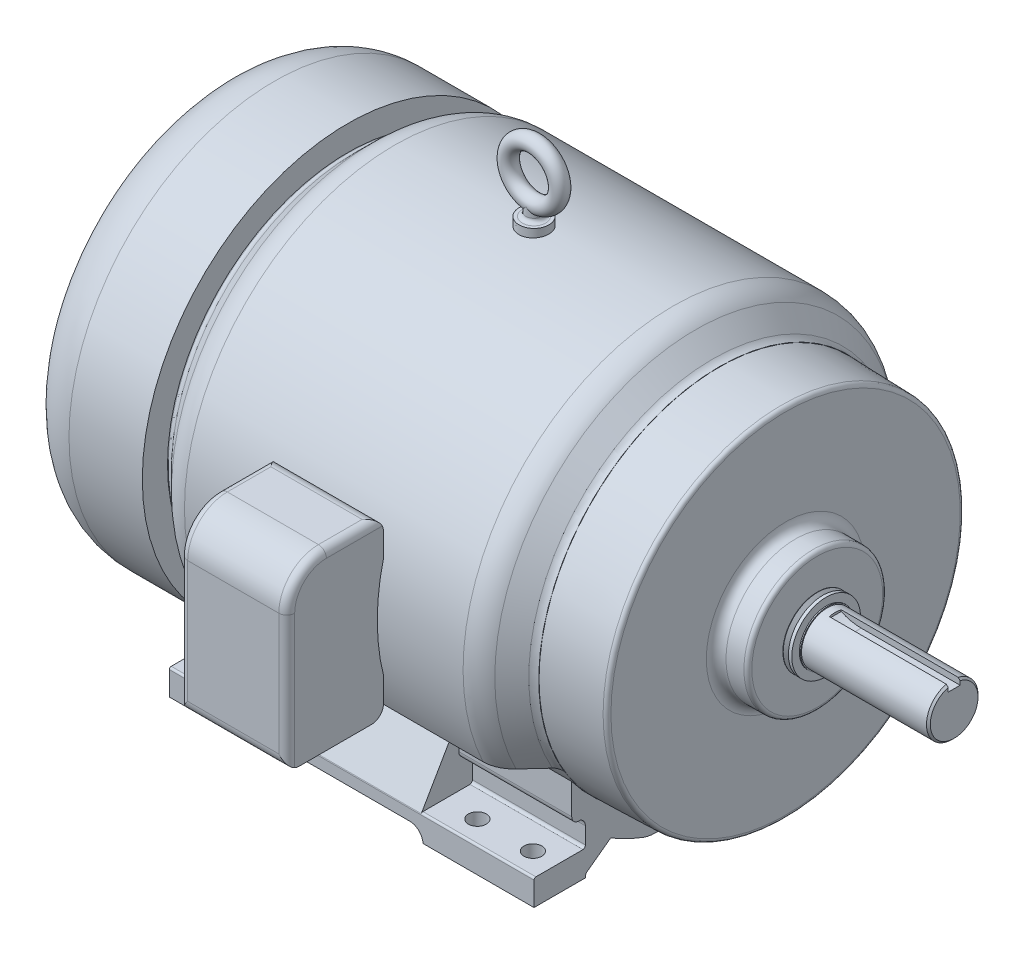
from build123d import *

# Parameters (mm, degrees)
SIDEBOX_DEPTH                     = 42.8625
F_25FILLETS_R                     = 6.35
KEYWAY_DEPTH                      = 4.7625
SKETCH10_R                        = 6.35
BOTTOMEXCESSCUT_REACH             = 476.428
BOTTOMEXCESSCUT_DIRECTION_2_REACH = 476.428
FEETBASE_DEPTH                    = 146.05
CENTERFOOTFRAME_DEPTH             = 55.5625
FOOTFRAMEBOTTOMCUT_DEPTH          = 254
SKETCH15_R                        = 7.1501
MOUNTINGHOLES_DEPTH               = 60.325


with BuildPart() as part:
    # Sketch3 → Base-Revolve (revolve)
    with BuildSketch(Plane.XY, mode=Mode.PRIVATE) as base_revolve_sk:
        with BuildLine():
            Line((335.03108, 20.6375), (234.95508, 20.6375))
            Line((234.95508, 20.6375), (234.95508, 21.4376))
            Line((234.95508, 21.4376), (234.0356, 21.4376))
            Line((234.0356, 21.4376), (234.0356, 27.559))
            Line((234.0356, 27.559), (231.368054594, 27.559))
            Line((231.368054594, 27.559), (229.7176, 23.749))
            Line((229.7176, 23.749), (227.206989958, 27.576898151))
            Line((227.206989958, 27.576898151), (226.9236, 27.576898151))
            Line((226.9236, 27.576898151), (226.9236, 52.451))
            ThreePointArc((226.9236, 52.451), (225.99366403, 54.69606403), (223.7486, 55.626))
            Line((223.7486, 55.626), (209.3976, 55.626))
            ThreePointArc((209.3976, 55.626), (203.829841205, 57.932241205), (201.5236, 63.5))
            Line((201.5236, 63.5), (201.5236, 139.915946102))
            ThreePointArc((201.5236, 139.915946102), (200.62285867, 142.131430812), (198.431711811, 143.089858109))
            Line((198.431711811, 143.089858109), (148.4376, 144.399))
            Line((148.4376, 144.399), (148.4376, 144.651171376))
            ThreePointArc((148.4376, 144.651171376), (145.587272946, 145.587103315), (143.162005348, 147.353005348))
            Line((143.162005348, 147.353005348), (129.552498454, 160.962512242))
            ThreePointArc((129.552498454, 160.962512242), (121.312145394, 166.468540126), (111.591986212, 168.402))
            Line((111.591986212, 168.402), (-111.591986212, 168.402))
            ThreePointArc((-111.591986212, 168.402), (-121.312145394, 166.468540126), (-129.552498454, 160.962512242))
            Line((-129.552498454, 160.962512242), (-143.162005348, 147.353005348))
            ThreePointArc((-143.162005348, 147.353005348), (-145.587272946, 145.587103315), (-148.4376, 144.651171376))
            Line((-148.4376, 144.651171376), (-148.4376, 144.399))
            Line((-148.4376, 144.399), (-149.1615, 144.399))
            Line((-149.1615, 144.399), (-149.1615, 164.58184))
            Line((-149.1615, 164.58184), (-207.899, 164.58184))
            ThreePointArc((-207.899, 164.58184), (-239.329896424, 151.562736424), (-252.349, 120.13184))
            Line((-252.349, 120.13184), (-252.349, 0))
            Line((-252.349, 0), (336.55508, 0))
            Line((336.55508, 0), (336.55508, 19.1135))
            Line((336.55508, 19.1135), (335.03108, 20.6375))
        make_face()
    revolve(base_revolve_sk.sketch.rotate(Axis((-274.934210914, 0, 0), (1, 0, 0)), 90), axis=Axis((-274.934210914, 0, 0), (1, 0, 0)))

    # Sketch6 → SideBox (add, symmetric)
    with BuildSketch(Plane(origin=(0, 0, 0), x_dir=(0, 0, -1), z_dir=(1, 0, 0))):
        with BuildLine():
            Line((-174.226684982, 69.853693224), (-209.151684982, 69.853693224))
            ThreePointArc((-209.151684982, 69.853693224), (-231.602325284, 60.554333526), (-240.901684982, 38.103693224))
            Line((-240.901684982, 38.103693224), (-240.901684982, -59.527556776))
            ThreePointArc((-240.901684982, -59.527556776), (-237.647697278, -67.058391987), (-229.9335, -69.85))
            Line((-229.9335, -69.85), (-173.0375, -69.85))
            ThreePointArc((-173.0375, -69.85), (-168.969320358, -68.950772041), (-165.659164106, -66.420641194))
            ThreePointArc((-165.659164106, -66.420641194), (-163.971718124, -63.510507053), (-163.3855, -60.198))
            Line((-163.3855, -60.198), (-163.3855, -41.529))
            Line((-163.3855, -41.529), (-161.8615, -40.005))
            Line((-161.8615, -40.005), (-160.274, -40.005))
            Line((-160.274, -40.005), (-160.274, -41.275))
            Line((-160.274, -41.275), (-131.555338234, -41.275))
            Line((-131.555338234, -41.275), (-131.555338234, 42.027024625))
            Line((-131.555338234, 42.027024625), (-160.274, 41.275))
            Line((-160.274, 41.275), (-160.274, 39.243))
            Line((-160.274, 39.243), (-161.8615, 39.243))
            Line((-161.8615, 39.243), (-163.3855, 40.767))
            Line((-163.3855, 40.767), (-163.3855, 59.436))
            ThreePointArc((-163.3855, 59.436), (-166.709045327, 66.827141265), (-174.226684982, 69.853693224))
        make_face()
    extrude(amount=SIDEBOX_DEPTH, both=True)

    # .25Fillets
    # the kernel refuses this fillet: 6.35 mm, written as the material it takes off along each edge
    with BuildSketch(Plane(origin=(-42.8625, 69.853693224, 158.351684982), x_dir=(0, -1, 0), z_dir=(0, 0, 1))) as f_25fillets_piece_1:
        with BuildLine():
            CenterArc((F_25FILLETS_R, F_25FILLETS_R), F_25FILLETS_R, 180, 90)
            Line((0, F_25FILLETS_R), (0, 0))
            Line((0, 0), (F_25FILLETS_R, 0))
        make_face()
    extrude(amount=50.8, mode=Mode.SUBTRACT)
    with BuildSketch(Plane(origin=(-42.8625, 38.103693224, 209.151684982), x_dir=(0, 1, 0), z_dir=(0, 0, -1))) as f_25fillets_piece_2:
        with BuildLine():
            CenterArc((31.75 - F_25FILLETS_R, F_25FILLETS_R), F_25FILLETS_R, 270, 90)
            Line((31.75, F_25FILLETS_R), (31.75, 0))
            Line((31.75, 0), (31.75 - F_25FILLETS_R, 0))
        make_face()
    revolve(axis=Axis((-42.8625, 38.103693224, 209.151684982), (1, 0, 0)), revolution_arc=90, mode=Mode.SUBTRACT)
    with BuildSketch(Plane(origin=(-42.8625, 38.103693224, 240.901684982), x_dir=(0, 0, -1), z_dir=(0, -1, 0))) as f_25fillets_piece_3:
        with BuildLine():
            CenterArc((F_25FILLETS_R, F_25FILLETS_R), F_25FILLETS_R, 180, 90)
            Line((0, F_25FILLETS_R), (0, 0))
            Line((0, 0), (F_25FILLETS_R, 0))
        make_face()
    extrude(amount=113.50625, mode=Mode.SUBTRACT)
    with BuildSketch(Plane(origin=(42.8625, 69.853693224, 158.351684982), x_dir=(0, -1, 0), z_dir=(0, 0, 1))) as f_25fillets_piece_4:
        with BuildLine():
            CenterArc((F_25FILLETS_R, -F_25FILLETS_R), F_25FILLETS_R, 90, 90)
            Line((0, -F_25FILLETS_R), (0, 0))
            Line((0, 0), (F_25FILLETS_R, 0))
        make_face()
    extrude(amount=50.8, mode=Mode.SUBTRACT)
    with BuildSketch(Plane(origin=(42.8625, 38.103693224, 209.151684982), x_dir=(0, 1, 0), z_dir=(0, 0, -1))) as f_25fillets_piece_5:
        with BuildLine():
            CenterArc((31.75 - F_25FILLETS_R, -F_25FILLETS_R), F_25FILLETS_R, 0, 90)
            Line((31.75, -F_25FILLETS_R), (31.75, 0))
            Line((31.75, 0), (31.75 - F_25FILLETS_R, 0))
        make_face()
    revolve(axis=Axis((42.8625, 38.103693224, 209.151684982), (1, 0, 0)), revolution_arc=90, mode=Mode.SUBTRACT)
    with BuildSketch(Plane(origin=(42.8625, 38.103693224, 240.901684982), x_dir=(0, 0, -1), z_dir=(0, -1, 0))) as f_25fillets_piece_6:
        with BuildLine():
            CenterArc((F_25FILLETS_R, -F_25FILLETS_R), F_25FILLETS_R, 90, 90)
            Line((0, -F_25FILLETS_R), (0, 0))
            Line((0, 0), (F_25FILLETS_R, 0))
        make_face()
    extrude(amount=113.50625, mode=Mode.SUBTRACT)

    # Sketch7 → KeyWay (cut, symmetric)
    with BuildSketch(Plane.XY):
        with BuildLine():
            Line((336.55508, 15.3289), (257.30708, 15.3289))
            ThreePointArc((257.30708, 15.3289), (249.114432843, 16.22015731), (241.30508, 18.852231624))
            Line((241.30508, 18.852231624), (241.30508, 28.0289))
            Line((241.30508, 28.0289), (336.55508, 28.0289))
            Line((336.55508, 28.0289), (336.55508, 15.3289))
        make_face()
    extrude(amount=KEYWAY_DEPTH, both=True, mode=Mode.SUBTRACT)

    # Sketch8 → LiftingRingBase (revolve)
    with BuildSketch(Plane(origin=(0, 0, 0), x_dir=(0, 0, -1), z_dir=(1, 0, 0))):
        with BuildLine():
            Line((0, 143.854199403), (0, 184.404))
            Line((0, 184.404), (6.35, 184.404))
            Line((6.35, 184.404), (6.35, 177.8))
            ThreePointArc((6.35, 177.8), (7.242738531, 175.644738531), (9.398, 174.752))
            Line((9.398, 174.752), (11.938, 174.752))
            Line((11.938, 174.752), (11.985458644, 166.589627503))
            Line((11.985458644, 166.589627503), (12.542129591, 145.331221721))
            ThreePointArc((12.542129591, 145.331221721), (12.950783633, 144.332008046), (13.918835799, 143.854199403))
            Line((13.918835799, 143.854199403), (0, 143.854199403))
        make_face()
    revolve(axis=Axis((0, 0, 0), (0, 1, 0)))

    # LiftingRing: sweep along a path in Sketch9
    with BuildLine(Plane.XY) as liftingring_path:
        CenterArc((0, 204.978), 26.924, 0, 360)
    # Sketch10 → LiftingRing (sweep)
    with BuildSketch(Plane(origin=(0, 0, 0), x_dir=(0, 0, -1), z_dir=(1, 0, 0))):
        with Locations((0, 225.552)):
            Circle(SKETCH10_R)
    sweep(path=liftingring_path.line)

    # BottomExcessCut: up to this face of the body (flat: up to its plane)
    bottomexcesscut_end = Plane(part.part.faces().sort_by_distance((-149.1615, 0, -149.054077405))[0])
    # Sketch11 → BottomExcessCut (cut, up to the picked face)
    with BuildSketch(Plane(origin=(0, 0, 0), x_dir=(0, 0, -1), z_dir=(1, 0, 0)), mode=Mode.PRIVATE) as bottomexcesscut_sk1:
        with BuildLine():
            Line((-127.771036414, -72.300770155), (-168.402, -71.23681093))
            Line((-168.402, -71.23681093), (-168.402, -168.402))
            Line((-168.402, -168.402), (168.402, -168.402))
            Line((168.402, -168.402), (168.402, -71.23681093))
            Line((168.402, -71.23681093), (127.771036414, -72.300770155))
            ThreePointArc((127.771036414, -72.300770155), (125.469463214, -72.954317647), (123.764628337, -74.632978291))
            ThreePointArc((123.764628337, -74.632978291), (0, -144.526), (-123.764628337, -74.632978291))
            ThreePointArc((-123.764628337, -74.632978291), (-125.469463214, -72.954317647), (-127.771036414, -72.300770155))
        make_face()
    bottomexcesscut_tool1 = split(extrude(bottomexcesscut_sk1.sketch, amount=-BOTTOMEXCESSCUT_REACH, mode=Mode.PRIVATE), bisect_by=bottomexcesscut_end, keep=Keep.BOTH, mode=Mode.PRIVATE)
    add(bottomexcesscut_tool1.solids().sort_by(Axis((0, -75.983804, 127.232986), (-1, 0, 0)))[0], mode=Mode.SUBTRACT)

    # BottomExcessCut direction 2: up to this face of the body (flat: up to its plane)
    bottomexcesscut_direction_2_end = Plane(part.part.faces().sort_by_distance((201.5236, 0, -67.457420571))[0])
    # Sketch11 → BottomExcessCut direction 2 (cut, up to the picked face)
    with BuildSketch(Plane(origin=(0, 0, 0), x_dir=(0, 0, -1), z_dir=(1, 0, 0)), mode=Mode.PRIVATE) as bottomexcesscut_direction_2_sk1:
        with BuildLine():
            Line((-127.771036414, -72.300770155), (-168.402, -71.23681093))
            Line((-168.402, -71.23681093), (-168.402, -168.402))
            Line((-168.402, -168.402), (168.402, -168.402))
            Line((168.402, -168.402), (168.402, -71.23681093))
            Line((168.402, -71.23681093), (127.771036414, -72.300770155))
            ThreePointArc((127.771036414, -72.300770155), (125.469463214, -72.954317647), (123.764628337, -74.632978291))
            ThreePointArc((123.764628337, -74.632978291), (0, -144.526), (-123.764628337, -74.632978291))
            ThreePointArc((-123.764628337, -74.632978291), (-125.469463214, -72.954317647), (-127.771036414, -72.300770155))
        make_face()
    bottomexcesscut_direction_2_tool1 = split(extrude(bottomexcesscut_direction_2_sk1.sketch, amount=BOTTOMEXCESSCUT_DIRECTION_2_REACH, mode=Mode.PRIVATE), bisect_by=bottomexcesscut_direction_2_end, keep=Keep.BOTH, mode=Mode.PRIVATE)
    add(bottomexcesscut_direction_2_tool1.solids().sort_by(Axis((0, -75.983804, 127.232986), (1, 0, 0)))[0], mode=Mode.SUBTRACT)

    # Sketch12 → FeetBase (add, symmetric)
    with BuildSketch(Plane(origin=(0, 0, 0), x_dir=(0, 0, -1), z_dir=(1, 0, 0))):
        with BuildLine():
            Line((-48.783080975, -155.575), (48.783080975, -155.575))
            ThreePointArc((48.783080975, -155.575), (53.85489975, -155.110812168), (58.758194792, -153.733672463))
            ThreePointArc((58.758194792, -153.733672463), (71.962366817, -148.013463125), (84.616402103, -141.161722855))
            Line((84.616402103, -141.161722855), (103.548105185, -155.133192259))
            ThreePointArc((103.548105185, -155.133192259), (104.543259395, -156.267948153), (104.902, -157.734))
            Line((104.902, -157.734), (104.902, -158.75))
            Line((104.902, -158.75), (146.05, -158.75))
            Line((146.05, -158.75), (146.05, -139.7))
            ThreePointArc((146.05, -139.7), (145.603630735, -138.622369265), (144.526, -138.176))
            Line((144.526, -138.176), (106.816175661, -138.145558171))
            ThreePointArc((106.816175661, -138.145558171), (105.445044688, -137.369156104), (104.902, -135.89))
            Line((104.902, -135.89), (104.902, -122.601179298))
            ThreePointArc((104.902, -122.601179298), (106.047665964, -118.962854513), (109.071262124, -116.637381656))
            ThreePointArc((109.071262124, -116.637381656), (113.778236327, -115.300126191), (115.824, -110.855049216))
            Line((115.824, -110.855049216), (115.824, -95.34372751))
            Line((115.824, -95.34372751), (115.824, -84.020881439))
            ThreePointArc((115.824, -84.020881439), (0, -143.089858109), (-115.824, -84.020881439))
            Line((-115.824, -84.020881439), (-115.824, -95.34372751))
            Line((-115.824, -95.34372751), (-115.824, -110.855049216))
            ThreePointArc((-115.824, -110.855049216), (-113.778236327, -115.300126191), (-109.071262124, -116.637381656))
            ThreePointArc((-109.071262124, -116.637381656), (-106.047665964, -118.962854513), (-104.902, -122.601179298))
            Line((-104.902, -122.601179298), (-104.902, -135.89))
            ThreePointArc((-104.902, -135.89), (-105.445044688, -137.369156104), (-106.816175661, -138.145558171))
            Line((-106.816175661, -138.145558171), (-144.526, -138.176))
            ThreePointArc((-144.526, -138.176), (-145.603630735, -138.622369265), (-146.05, -139.7))
            Line((-146.05, -139.7), (-146.05, -158.75))
            Line((-146.05, -158.75), (-104.902, -158.75))
            Line((-104.902, -158.75), (-104.902, -157.734))
            ThreePointArc((-104.902, -157.734), (-104.543259395, -156.267948153), (-103.548105185, -155.133192259))
            Line((-103.548105185, -155.133192259), (-84.616402103, -141.161722855))
            ThreePointArc((-84.616402103, -141.161722855), (-71.962366817, -148.013463125), (-58.758194792, -153.733672463))
            ThreePointArc((-58.758194792, -153.733672463), (-53.85489975, -155.110812168), (-48.783080975, -155.575))
        make_face()
    extrude(amount=FEETBASE_DEPTH, both=True)

    # Sketch13 → CenterFootFrame (add, symmetric)
    with BuildSketch(Plane(origin=(0, 0, 0), x_dir=(0, 0, -1), z_dir=(1, 0, 0))):
        with BuildLine():
            Line((-145.845822715, -138.938), (-117.726000561, -90.233039329))
            ThreePointArc((-117.726000561, -90.233039329), (-116.88190227, -86.767713784), (-118.03901348, -83.393980435))
            Line((-118.03901348, -83.393980435), (118.03901348, -83.393980435))
            ThreePointArc((118.03901348, -83.393980435), (116.88190227, -86.767713784), (117.726000561, -90.233039329))
            Line((117.726000561, -90.233039329), (145.845822715, -138.938))
            Line((145.845822715, -138.938), (-145.845822715, -138.938))
        make_face()
    extrude(amount=CENTERFOOTFRAME_DEPTH, both=True)

    # Sketch14 → FootFrameBottomCut (cut, symmetric)
    with BuildSketch(Plane.XY):
        with BuildLine():
            Line((-57.15, -159.512), (57.136622308, -160.02))
            ThreePointArc((57.136622308, -160.02), (54.61763281, -152.365198458), (47.498, -148.59))
            Line((47.498, -148.59), (-47.498, -148.59))
            ThreePointArc((-47.498, -148.59), (-54.442357332, -152.178963288), (-57.15, -159.512))
        make_face()
    extrude(amount=FOOTFRAMEBOTTOMCUT_DEPTH, both=True, mode=Mode.SUBTRACT)

    # Sketch15 → MountingHoles (cut)
    with BuildSketch(Plane.XZ.offset(158.75)):
        with Locations(Location((82.55508, 127.897366366, 0), (0, 0, 270))):
            Circle(SKETCH15_R)
        with Locations(Location((-82.54492, 127.897366366, 0), (0, 0, 90))):
            Circle(SKETCH15_R)
        with Locations(Location((127.00508, 127.897366366, 0), (0, 0, 270))):
            Circle(SKETCH15_R)
        with Locations(Location((-126.99492, 127.897366366, 0), (0, 0, 90))):
            Circle(SKETCH15_R)
        with Locations(Location((-126.99492, -127.897366366, 0), (0, 0, 270))):
            Circle(SKETCH15_R)
        with Locations(Location((127.00508, -127.897366366, 0), (0, 0, 270))):
            Circle(SKETCH15_R)
        with Locations(Location((-82.54492, -127.897366366, 0), (0, 0, 270))):
            Circle(SKETCH15_R)
        with Locations(Location((82.55508, -127.897366366, 0), (0, 0, 270))):
            Circle(SKETCH15_R)
    extrude(amount=-MOUNTINGHOLES_DEPTH, mode=Mode.SUBTRACT)


solid = part.part
